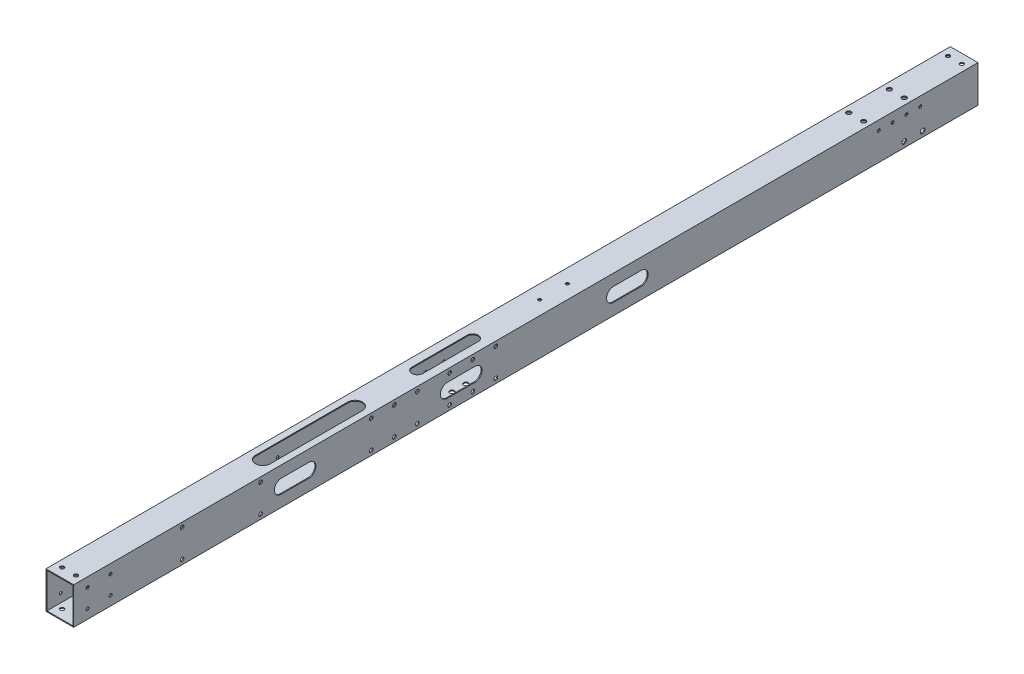
from build123d import *

# Parameters (mm, degrees)
SKETCH_1_W             = 30
SKETCH_1_H             = 40
SKETCH_1_W_2           = 28
SKETCH_1_H_2           = 38
EXTRUDE_1_DEPTH        = 940
SKETCH_5_R             = 2.5
CUT_EXTRUDE_3_DEPTH    = 941.97024395
CUT_EXTRUDE_4_DEPTH    = 1
SKETCH_7_R             = 1.5
CUT_EXTRUDE_5_DEPTH    = 1
SKETCH_17_W            = 30
SKETCH_17_H            = 40
SKETCH_17_W_2          = 28
SKETCH_17_H_2          = 38
EXTRUDE_2_DEPTH        = 20
SKETCH_18_W            = 30
SKETCH_18_H            = 40
SKETCH_18_W_2          = 28
SKETCH_18_H_2          = 38
EXTRUDE_3_DEPTH        = 20
SKETCH_19_R            = 2.1
CUT_EXTRUDE_16_DEPTH   = 961.950050731
SKETCH_20_R            = 1.6
CUT_EXTRUDE_17_DEPTH   = 961.67684473
SKETCH_21_R            = 2.5
SKETCH_21_R_2          = 1.6
CUT_EXTRUDE_18_DEPTH   = 961.67684473
SKETCH_23_R            = 2.5
CUT_EXTRUDE_19_DEPTH   = 961.950050731
SKETCH_24_R            = 4.5
CUT_EXTRUDE_20_DEPTH   = 10
SKETCH_26_R            = 2
CUT_EXTRUDE_22_DEPTH   = 961.67684473
CUT_EXTRUDE_28_DEPTH   = 10
PATTERN_LINEAR_4_COUNT = 2
PATTERN_LINEAR_4_PITCH = 255
PATTERN_LINEAR_8_COUNT = 2
PATTERN_LINEAR_8_PITCH = 205
PATTERN_LINEAR_9_COUNT = 2
PATTERN_LINEAR_9_PITCH = 230
CUT_EXTRUDE_START      = -20
SKETCH_34_R            = 1.75
CUT_EXTRUDE_29_DEPTH   = 20
SKETCH_35_R            = 1.5
CUT_EXTRUDE_30_DEPTH   = 10
CUT_EXTRUDE_31_DEPTH   = 10
SKETCH_37_R            = 1.65
CUT_EXTRUDE_32_DEPTH   = 3


with BuildPart() as part:
    # 草图1 → 凸台-拉伸1 (new body)
    with BuildSketch(Plane.XY):
        Rectangle(SKETCH_1_W, SKETCH_1_H)
        Rectangle(SKETCH_1_W_2, SKETCH_1_H_2, mode=Mode.SUBTRACT)
    extrude(amount=EXTRUDE_1_DEPTH)

    # 草图5 → 切除-拉伸3 (cut, through all)
    with BuildSketch(Plane.XZ.offset(20)):
        with Locations((-8, 53)):
            Circle(SKETCH_5_R)
        with Locations((8, 53)):
            Circle(SKETCH_5_R)
        with Locations((-8, 97)):
            Circle(SKETCH_5_R)
        with Locations((8, 97)):
            Circle(SKETCH_5_R)
    extrude(amount=-CUT_EXTRUDE_3_DEPTH, mode=Mode.SUBTRACT)

    # 草图6 → 切除-拉伸4 (cut)
    with BuildSketch(Plane(origin=(15, 0, 0), x_dir=(0, 0, -1), z_dir=(1, 0, 0))):
        with BuildLine():
            Line((-345, -7.5), (-375, -7.5))
            ThreePointArc((-375, -7.5), (-382.5, 0), (-375, 7.5))
            Line((-375, 7.5), (-345, 7.5))
            ThreePointArc((-345, 7.5), (-337.5, 0), (-345, -7.5))
        make_face()
        with BuildLine():
            Line((-525, -7.5), (-555, -7.5))
            ThreePointArc((-555, -7.5), (-562.5, 0), (-555, 7.5))
            Line((-555, 7.5), (-525, 7.5))
            ThreePointArc((-525, 7.5), (-517.5, 0), (-525, -7.5))
        make_face()
        with BuildLine():
            Line((-705, -7.5), (-735, -7.5))
            ThreePointArc((-735, -7.5), (-742.5, 0), (-735, 7.5))
            Line((-735, 7.5), (-705, 7.5))
            ThreePointArc((-705, 7.5), (-697.5, 0), (-705, -7.5))
        make_face()
    extrude(amount=-CUT_EXTRUDE_4_DEPTH, mode=Mode.SUBTRACT)

    # 草图7 → 切除-拉伸5 (cut)
    with BuildSketch(Plane.ZY.offset(15)):
        with Locations((350, 0)):
            Circle(SKETCH_7_R)
        with Locations((370, 0)):
            Circle(SKETCH_7_R)
        with Locations((530, 0)):
            Circle(SKETCH_7_R)
        with Locations((550, 0)):
            Circle(SKETCH_7_R)
        with Locations((710, 0)):
            Circle(SKETCH_7_R)
        with Locations((730, 0)):
            Circle(SKETCH_7_R)
    extrude(amount=-CUT_EXTRUDE_5_DEPTH, mode=Mode.SUBTRACT)

    # 草图17 → 凸台-拉伸2 (add)
    with BuildSketch(Plane.XY.offset(940)):
        Rectangle(SKETCH_17_W, SKETCH_17_H)
        Rectangle(SKETCH_17_W_2, SKETCH_17_H_2, mode=Mode.SUBTRACT)
    extrude(amount=EXTRUDE_2_DEPTH)

    # 草图18 → 凸台-拉伸3 (add)
    with BuildSketch(Plane(origin=(0, 0, 0), x_dir=(-1, 0, 0), z_dir=(0, 0, -1))):
        Rectangle(SKETCH_18_W, SKETCH_18_H)
        Rectangle(SKETCH_18_W_2, SKETCH_18_H_2, mode=Mode.SUBTRACT)
    extrude(amount=EXTRUDE_3_DEPTH)

    # 草图19 → 切除-拉伸16 (cut, through all)
    with BuildSketch(Plane(origin=(0, 20, 0), x_dir=(1, 0, 0), z_dir=(0, 1, 0))):
        with Locations((-7.5, -950)):
            Circle(SKETCH_19_R)
        with Locations((7.5, -950)):
            Circle(SKETCH_19_R)
        with Locations((-7.5, 10)):
            Circle(SKETCH_19_R)
        with Locations((7.5, 10)):
            Circle(SKETCH_19_R)
    extrude(amount=-CUT_EXTRUDE_16_DEPTH, mode=Mode.SUBTRACT)

    # 草图20 → 切除-拉伸17 (cut, through all)
    with BuildSketch(Plane(origin=(15, 0, 0), x_dir=(0, 0, -1), z_dir=(1, 0, 0))):
        with Locations((-945, 10)):
            Circle(SKETCH_20_R)
        with Locations((-920, 10)):
            Circle(SKETCH_20_R)
        with Locations((-920, -10)):
            Circle(SKETCH_20_R)
        with Locations((-945, -10)):
            Circle(SKETCH_20_R)
    extrude(amount=-CUT_EXTRUDE_17_DEPTH, mode=Mode.SUBTRACT)

    # 草图21 → 切除-拉伸18 (cut, through all)
    with BuildSketch(Plane(origin=(15, 0, 0), x_dir=(0, 0, -1), z_dir=(1, 0, 0))):
        with Locations((-40, -14)):
            Circle(SKETCH_21_R)
        with Locations((-60, -14)):
            Circle(SKETCH_21_R)
        with Locations((-42.5, 10)):
            Circle(SKETCH_21_R_2)
        with Locations((-57.5, 10)):
            Circle(SKETCH_21_R_2)
        with Locations((-72.5, 10)):
            Circle(SKETCH_21_R_2)
        with Locations((-87.5, 10)):
            Circle(SKETCH_21_R_2)
    extrude(amount=-CUT_EXTRUDE_18_DEPTH, mode=Mode.SUBTRACT)

    # 草图23 → 切除-拉伸19 (cut, through all)
    with BuildSketch(Plane(origin=(0, 20, 0), x_dir=(1, 0, 0), z_dir=(0, 1, 0))):
        with Locations((0, -520)):
            Circle(SKETCH_23_R)
        with Locations((0, -535)):
            Circle(SKETCH_23_R)
        with Locations((0, -550)):
            Circle(SKETCH_23_R)
        with Locations((0, -565)):
            Circle(SKETCH_23_R)
    extrude(amount=-CUT_EXTRUDE_19_DEPTH, mode=Mode.SUBTRACT)

    # 草图24 → 切除-拉伸20 (cut)
    with BuildSketch(Plane(origin=(0, 20, 0), x_dir=(1, 0, 0), z_dir=(0, 1, 0))):
        with Locations((0, -520)):
            Circle(SKETCH_24_R)
        with Locations((0, -535)):
            Circle(SKETCH_24_R)
        with Locations((0, -550)):
            Circle(SKETCH_24_R)
        with Locations((0, -565)):
            Circle(SKETCH_24_R)
    extrude(amount=-CUT_EXTRUDE_20_DEPTH, mode=Mode.SUBTRACT)

    # 草图26 → 切除-拉伸22 (cut, through all)
    with BuildSketch(Plane(origin=(15, 0, 0), x_dir=(0, 0, -1), z_dir=(1, 0, 0))):
        with Locations((-842.5, 15)):
            Circle(SKETCH_26_R)
        with Locations((-842.5, -15)):
            Circle(SKETCH_26_R)
        with Locations((-757.5, -15)):
            Circle(SKETCH_26_R)
        with Locations((-757.5, 15)):
            Circle(SKETCH_26_R)
    cut_extrude_22 = extrude(amount=-CUT_EXTRUDE_22_DEPTH, mode=Mode.SUBTRACT)

    # 草图33 → 切除-拉伸28 (cut)
    with BuildSketch(Plane(origin=(0, 20, 0), x_dir=(1, 0, 0), z_dir=(0, 1, 0))):
        with BuildLine():
            Line((6, -512.5), (6, -572.5))
            ThreePointArc((6, -572.5), (0, -578.5), (-6, -572.5))
            Line((-6, -572.5), (-6, -512.5))
            ThreePointArc((-6, -512.5), (0, -506.5), (6, -512.5))
        make_face()
    extrude(amount=-CUT_EXTRUDE_28_DEPTH, mode=Mode.SUBTRACT)

    # 阵列(线性)4: 切除-拉伸22 ×2
    with Locations(*[(0, 0, -i * PATTERN_LINEAR_4_PITCH) for i in range(1, PATTERN_LINEAR_4_COUNT)]):
        add(cut_extrude_22, mode=Mode.SUBTRACT)

    # 阵列(线性)8: 切除-拉伸22 ×2
    with Locations(*[(0, 0, -i * PATTERN_LINEAR_8_PITCH) for i in range(1, PATTERN_LINEAR_8_COUNT)]):
        add(cut_extrude_22, mode=Mode.SUBTRACT)

    # 阵列(线性)9: 切除-拉伸22 ×2
    with Locations(*[(0, 0, -i * PATTERN_LINEAR_9_PITCH) for i in range(1, PATTERN_LINEAR_9_COUNT)]):
        add(cut_extrude_22, mode=Mode.SUBTRACT)

    # 草图34 → 切除-拉伸29 (cut)
    with BuildSketch(Plane(origin=(15, 0, 0), x_dir=(0, 0, -1), z_dir=(1, 0, 0)).offset(CUT_EXTRUDE_START)):
        with Locations((-935, 0)):
            Circle(SKETCH_34_R)
        with Locations((-915, 0)):
            Circle(SKETCH_34_R)
    extrude(amount=-CUT_EXTRUDE_29_DEPTH, mode=Mode.SUBTRACT)

    # 草图35 → 切除-拉伸30 (cut)
    with BuildSketch(Plane.XZ.offset(20)):
        with Locations((5, 720)):
            Circle(SKETCH_35_R)
        with Locations((5, 700)):
            Circle(SKETCH_35_R)
        with Locations((5, 680)):
            Circle(SKETCH_35_R)
        with Locations((5, 660)):
            Circle(SKETCH_35_R)
        with Locations((5, 640)):
            Circle(SKETCH_35_R)
        with Locations((5, 740)):
            Circle(SKETCH_35_R)
    extrude(amount=-CUT_EXTRUDE_30_DEPTH, mode=Mode.SUBTRACT)

    # 草图36 → 切除-拉伸31 (cut)
    with BuildSketch(Plane(origin=(0, 20, 0), x_dir=(1, 0, 0), z_dir=(0, 1, 0))):
        with BuildLine():
            Line((8, -640), (8, -740))
            ThreePointArc((8, -740), (0, -748), (-8, -740))
            Line((-8, -740), (-8, -640))
            ThreePointArc((-8, -640), (0, -632), (8, -640))
        make_face()
    extrude(amount=-CUT_EXTRUDE_31_DEPTH, mode=Mode.SUBTRACT)

    # 草图37 → 切除-拉伸32 (cut)
    with BuildSketch(Plane(origin=(0, 20, 0), x_dir=(1, 0, 0), z_dir=(0, 1, 0))):
        with Locations((0, -410)):
            Circle(SKETCH_37_R)
        with Locations((0, -440)):
            Circle(SKETCH_37_R)
    extrude(amount=-CUT_EXTRUDE_32_DEPTH, mode=Mode.SUBTRACT)


solid = part.part
